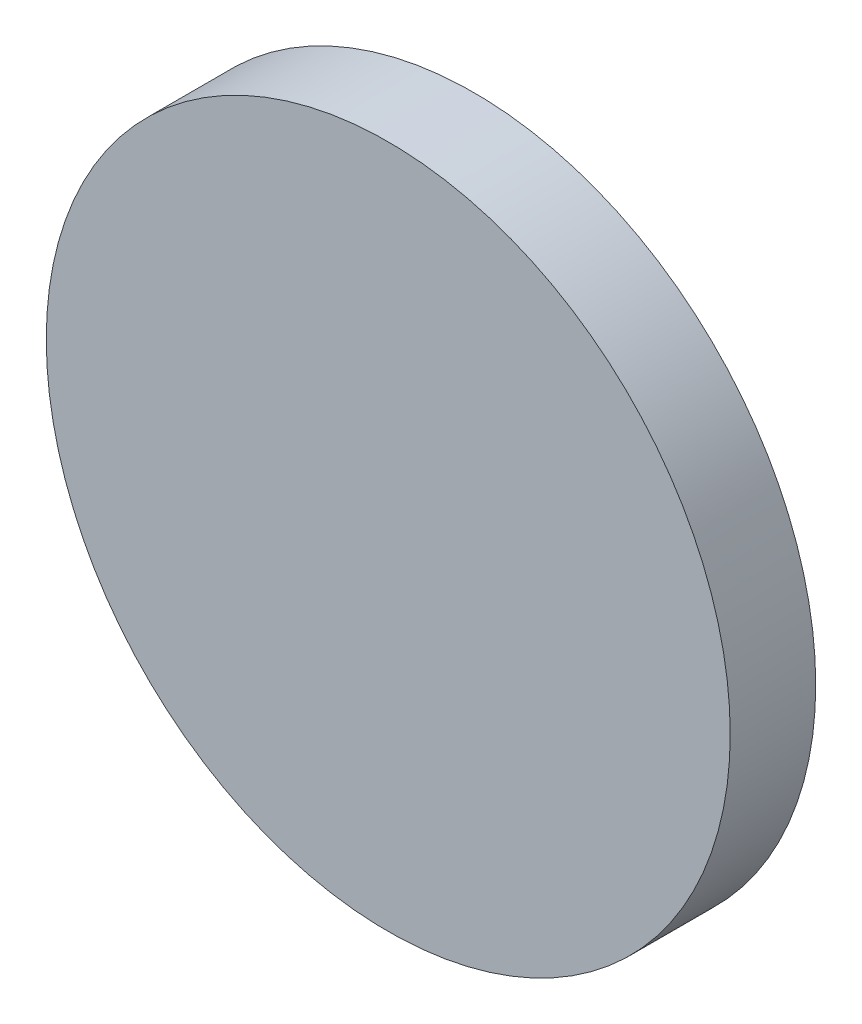
from build123d import *

# Parameters (mm, degrees)
SKETCH_1_R      = 20
EXTRUDE_1_DEPTH = 5


with BuildPart() as part:
    # 草图1 → 凸台-拉伸1 (new body)
    with BuildSketch(Plane.XY):
        Circle(SKETCH_1_R)
    extrude(amount=EXTRUDE_1_DEPTH)


solid = part.part
